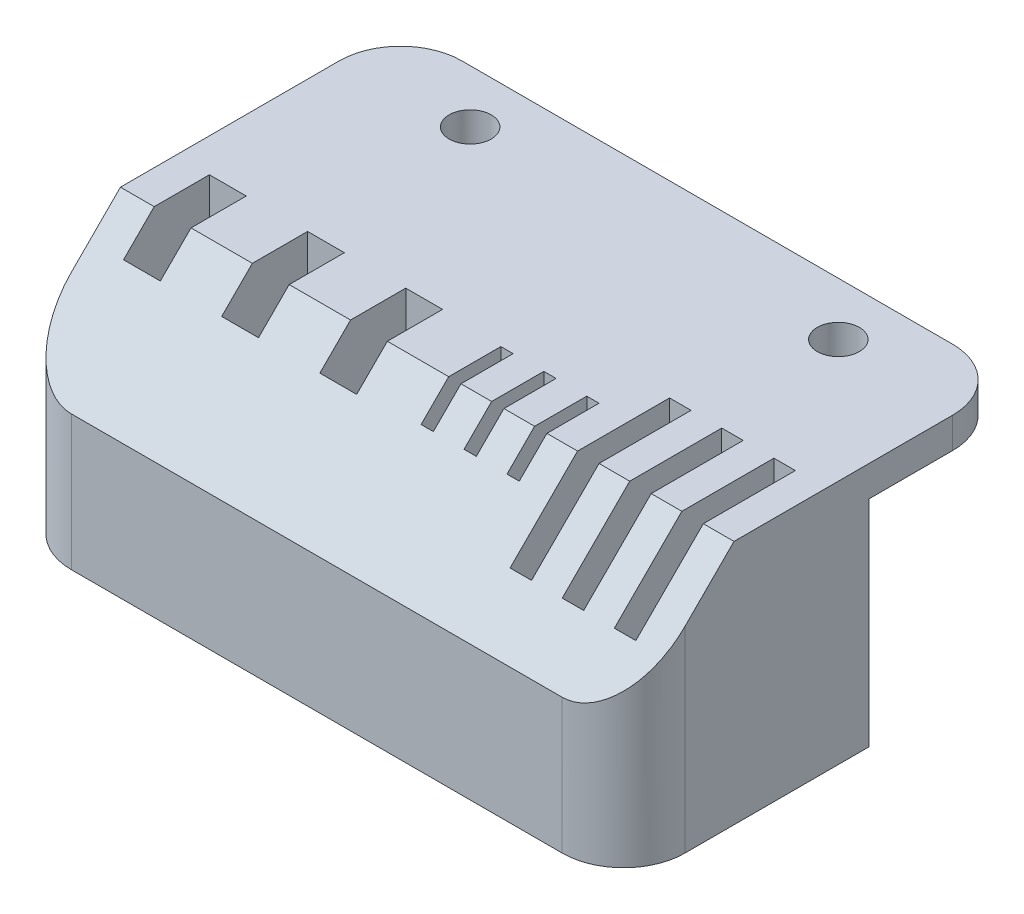
from build123d import *

# Parameters (mm, degrees)
SKETCH1_W           = 100
SKETCH1_H           = 30
BOSS_EXTRUDE1_DEPTH = 5
SKETCH2_W           = 100
SKETCH2_H           = 40
BOSS_EXTRUDE2_DEPTH = 40
SKETCH3_W           = 3.5
SKETCH3_H           = 26
CUT_EXTRUDE1_DEPTH  = 25
SKETCH4_W           = 2
SKETCH4_H           = 13
CUT_EXTRUDE2_DEPTH  = 10
SKETCH5_W           = 6
SKETCH5_H           = 14
CUT_EXTRUDE3_DEPTH  = 85.409715081
CHAMFER1_SIZE       = 18
SKETCH6_R           = 3.429
CUT_EXTRUDE4_DEPTH  = 85.409715081
SKETCH7_W           = 100
SKETCH7_H           = 6.35
CUT_EXTRUDE5_DEPTH  = 85.409715081
FILLET1_R           = 10


with BuildPart() as part:
    # Sketch1 → Boss-Extrude1 (new body)
    with BuildSketch(Plane(origin=(0, 0, 0), x_dir=(1, 0, 0), z_dir=(0, 1, 0))):
        Rectangle(SKETCH1_W, SKETCH1_H)
    extrude(amount=BOSS_EXTRUDE1_DEPTH)

    # Sketch2 → Boss-Extrude2 (add)
    with BuildSketch(Plane.XY.offset(15)):
        with Locations((0, -15)):
            Rectangle(SKETCH2_W, SKETCH2_H)
    extrude(amount=BOSS_EXTRUDE2_DEPTH)

    # Sketch3 → Cut-Extrude1 (cut)
    with BuildSketch(Plane(origin=(0, 5, 0), x_dir=(1, 0, 0), z_dir=(0, 1, 0))):
        with Locations((43.25, -35)):
            Rectangle(SKETCH3_W, SKETCH3_H)
        with Locations((34.75, -35)):
            Rectangle(SKETCH3_W, SKETCH3_H)
        with Locations((26.25, -35)):
            Rectangle(SKETCH3_W, SKETCH3_H)
    extrude(amount=-CUT_EXTRUDE1_DEPTH, mode=Mode.SUBTRACT)

    # Sketch4 → Cut-Extrude2 (cut)
    with BuildSketch(Plane(origin=(0, 5, 0), x_dir=(1, 0, 0), z_dir=(0, 1, 0))):
        with Locations((18.5, -35)):
            Rectangle(SKETCH4_W, SKETCH4_H)
        with Locations((11.5, -35)):
            Rectangle(SKETCH4_W, SKETCH4_H)
        with Locations((4.5, -35)):
            Rectangle(SKETCH4_W, SKETCH4_H)
    extrude(amount=-CUT_EXTRUDE2_DEPTH, mode=Mode.SUBTRACT)

    # Sketch5 → Cut-Extrude3 (cut, through all)
    with BuildSketch(Plane(origin=(0, 5, 0), x_dir=(1, 0, 0), z_dir=(0, 1, 0))):
        with Locations((-9.5, -35)):
            Rectangle(SKETCH5_W, SKETCH5_H)
        with Locations((-25.5, -35)):
            Rectangle(SKETCH5_W, SKETCH5_H)
        with Locations((-41.5, -35)):
            Rectangle(SKETCH5_W, SKETCH5_H)
    extrude(amount=-CUT_EXTRUDE3_DEPTH, mode=Mode.SUBTRACT)

    # Chamfer1
    # the kernel refuses this chamfer: 18 mm, written as the material it takes off along each edge
    with BuildSketch(Plane(origin=(-96.290293783, 5, 55), x_dir=(0, -0.9996219169112966, 0.02749587661058639), z_dir=(1, 0, 0))) as chamfer1_piece_1:
        Polygon((CHAMFER1_SIZE * 0.999621916911, CHAMFER1_SIZE * 0.0274958766106), (-CHAMFER1_SIZE * 0.0274958766106, CHAMFER1_SIZE * 0.999621916911), (0, 0), align=None)
    extrude(amount=192.580587567, mode=Mode.SUBTRACT)

    # Sketch6 → Cut-Extrude4 (cut, through all)
    with BuildSketch(Plane(origin=(0, 5, 0), x_dir=(1, 0, 0), z_dir=(0, 1, 0))):
        with Locations(Location((-30, 0, 0), (0, 0, 270))):
            Circle(SKETCH6_R)
        with Locations(Location((30, 0, 0), (0, 0, 270))):
            Circle(SKETCH6_R)
    extrude(amount=-CUT_EXTRUDE4_DEPTH, mode=Mode.SUBTRACT)

    # Sketch7 → Cut-Extrude5 (cut, through all)
    with BuildSketch(Plane(origin=(0, 5, 0), x_dir=(1, 0, 0), z_dir=(0, 1, 0))):
        with Locations((0, 11.825)):
            Rectangle(SKETCH7_W, SKETCH7_H)
    extrude(amount=-CUT_EXTRUDE5_DEPTH, mode=Mode.SUBTRACT)

    # Fillet1
    fillet1_edges = [part.edges().sort_by_distance(p)[0] for p in [
        (-50, -24, 55),
        (50, -24, 55),
        (-50, 2.5, -8.65),
        (50, 2.5, -8.65),
    ]]
    fillet(fillet1_edges, radius=FILLET1_R)


solid = part.part
